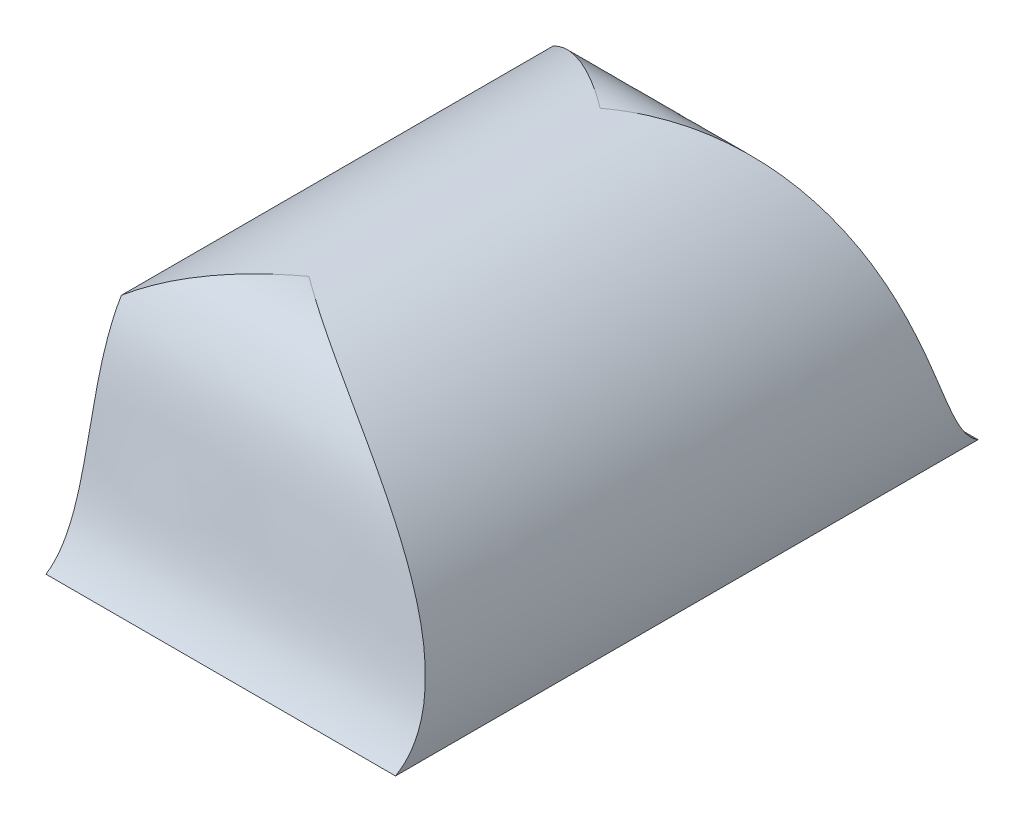
from build123d import *

# Parameters (mm, degrees)
BOSS_EXTRUDE1_DEPTH     = 0.25
BOSS_EXTRUDE2_START     = -0.246147001
BOSS_EXTRUDE2_DEPTH     = 0.246147001
BOSS_EXTRUDE2_START_2   = 0.246147001
BOSS_EXTRUDE2_2_DEPTH   = 0.355236273
BOSS_EXTRUDE2_START_3   = 0.25
BOSS_EXTRUDE2_3_DEPTH   = 1.75
CUT_EXTRUDE1_DEPTH      = 1.887043447
CUT_EXTRUDE1_DEPTH_BACK = 1.887043447


with BuildPart() as part:
    # Sketch1 → Boss-Extrude1 (new, symmetric)
    with BuildSketch(Plane.XY):
        with BuildLine():
            Line((0, 0.35), (0, 0))
            Line((0, 0), (0.6, 0))
            add(Edge.make_bspline(
                [(0, 0.35), (0.257985516, 0.5453908), (0.626819788, 0.289928398), (0.6, 0)],
                knots=[0, 0, 0, 0, 1, 1, 1, 1], degree=3))
        make_face()
    extrude(amount=BOSS_EXTRUDE1_DEPTH, both=True)

    # Boss-Extrude2: read off the stored shape, not the designer's step
    # Boss-Extrude2 outline → Boss-Extrude2 (add)
    with BuildSketch(Plane.ZY.offset(BOSS_EXTRUDE2_START)):
        with BuildLine():
            Line((0.25, 0), (0.5, 0))
            add(Edge.make_bspline(
                [(0.5, 0), (0.39086499, 0.071490544), (0.458561007, 0.418548902), (0.25, 0.418548902)],
                knots=[0, 0, 0, 0, 1, 1, 1, 1], degree=3))
            Line((0.25, 0.418548902), (0.25, 0))
        make_face()
    boss_extrude2 = extrude(amount=BOSS_EXTRUDE2_DEPTH)

    # Boss-Extrude2 2 outline → Boss-Extrude2 2 (add)
    with BuildSketch(Plane.YZ.offset(BOSS_EXTRUDE2_START_2)):
        with BuildLine():
            add(Edge.make_bspline(
                [(0, 0.5), (0.071490544, 0.39086499), (0.418548902, 0.458561007), (0.418548902, 0.25)],
                knots=[0, 0, 0, 0, 1, 1, 1, 1], degree=3))
            Line((0, 0.5), (0, 0.25))
            Line((0, 0.25), (0.418548902, 0.25))
        make_face()
    boss_extrude2_2 = extrude(amount=BOSS_EXTRUDE2_2_DEPTH)

    # Boss-Extrude2 3 outline → Boss-Extrude2 3 (cut)
    with BuildSketch(Plane.XY.offset(BOSS_EXTRUDE2_START_3)):
        with BuildLine():
            Line((0.601383274, 0.418548902), (0.201485184, 0.418548902))
            add(Edge.make_bspline(
                [(0.201485184, 0.418548902), (0.404568721, 0.4185489), (0.600980368, 0.237363776), (0.601383274, 0.030644082)],
                knots=[0.70274, 0.70274, 0.70274, 0.70274, 1.423102498, 1.423102498, 1.423102498, 1.423102498], degree=3))
            Line((0.601383274, 0.030644082), (0.601383274, 0.418548902))
        make_face()
        with BuildLine():
            Line((0.601383274, 0), (0.601383274, 0.029369833))
            add(Edge.make_bspline(
                [(0.6, 0), (0.600909788, 0.009835023), (0.601364288, 0.019630385), (0.601383274, 0.029369833)],
                knots=[0, 0, 0, 0, 0.033922248, 0.033922248, 0.033922248, 0.033922248], degree=3))
            Line((0.6, 0), (0.601383274, 0))
        make_face()
    boss_extrude2_3 = extrude(amount=BOSS_EXTRUDE2_3_DEPTH, mode=Mode.SUBTRACT)

    # Mirror1: Boss-Extrude2, Boss-Extrude2 2, Boss-Extrude2 3 across plane
    add(boss_extrude2.mirror(Plane.XY))
    add(boss_extrude2_2.mirror(Plane.XY))
    add(boss_extrude2_3.mirror(Plane.XY), mode=Mode.SUBTRACT)

    # Sketch3 → Cut-Extrude1 (cut, two sides: drawn at the far end of the back side and taken through both)
    with BuildSketch(Plane.XY.offset(-CUT_EXTRUDE1_DEPTH_BACK)):
        with BuildLine():
            Line((0, 0.418548902), (0, 0.35))
            add(Edge.make_bspline(
                [(0.201485181, 0.418548902), (0.132630672, 0.418548902), (0.063009218, 0.397721367), (0, 0.35)],
                knots=[0.755764514, 0.755764514, 0.755764514, 0.755764514, 1, 1, 1, 1], degree=3))
            Line((0.201485181, 0.418548902), (0, 0.418548902))
        make_face()
    extrude(amount=CUT_EXTRUDE1_DEPTH + CUT_EXTRUDE1_DEPTH_BACK, mode=Mode.SUBTRACT)


solid = part.part
